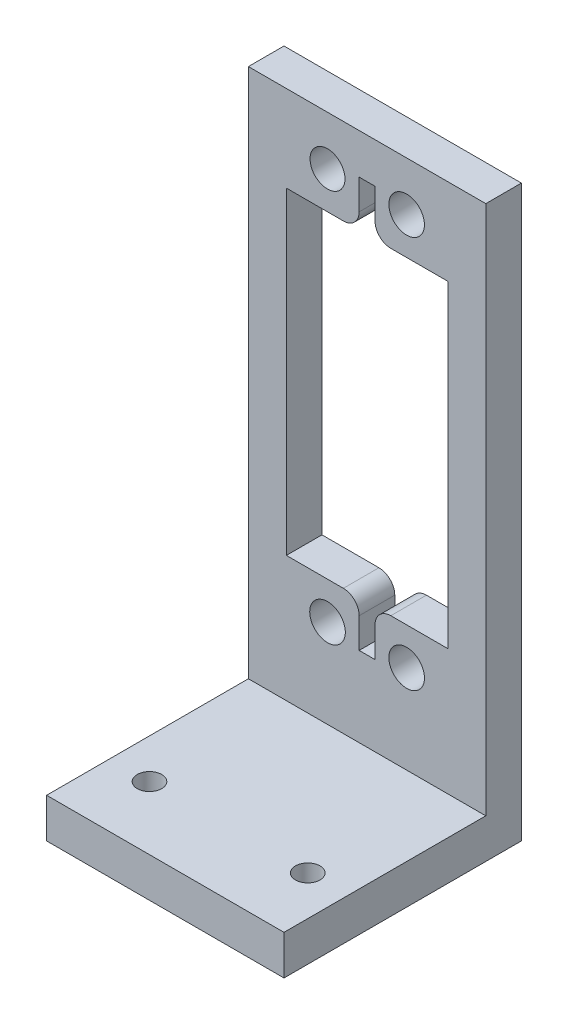
from build123d import *

# Parameters (mm, degrees)
SKETCH_1_W          = 30
SKETCH_1_H          = 62
SKETCH_1_W_2        = 20.4
SKETCH_1_H_2        = 40.2
EXTRUDE_1_DEPTH     = 4.5
SKETCH_3_R          = 2.25
SKETCH_3_R_2        = 2.20649786
CUT_EXTRUDE_1_DEPTH = 35.731109974
SKETCH_5_W          = 30
SKETCH_5_H          = 4.5
EXTRUDE_3_DEPTH     = 5
SKETCH_6_W          = 30
SKETCH_6_H          = 30
EXTRUDE_4_DEPTH     = 5
SKETCH_7_R          = 1.55
CUT_EXTRUDE_2_DEPTH = 80.429213769
SKETCH_8_W          = 2
SKETCH_8_H          = 5.8
CUT_EXTRUDE_3_DEPTH = 51.55937104
FILLET_1_R          = 2


with BuildPart() as part:
    # 草图1 → 凸台-拉伸1 (new body)
    with BuildSketch(Plane.XY):
        Rectangle(SKETCH_1_W, SKETCH_1_H)
        Rectangle(SKETCH_1_W_2, SKETCH_1_H_2, mode=Mode.SUBTRACT)
    extrude(amount=EXTRUDE_1_DEPTH)

    # 草图3 → 切除-拉伸1 (cut, through all)
    with BuildSketch(Plane(origin=(0, 0, 0), x_dir=(-1, 0, 0), z_dir=(0, 0, -1))):
        with Locations((-5, -24.8)):
            Circle(SKETCH_3_R)
        with Locations((5, -24.8)):
            Circle(SKETCH_3_R)
        with Locations((-5, 24.8)):
            Circle(SKETCH_3_R)
        with Locations((5, 24.8)):
            Circle(SKETCH_3_R_2)
    extrude(amount=-CUT_EXTRUDE_1_DEPTH, mode=Mode.SUBTRACT)

    # 草图5 → 凸台-拉伸3 (add)
    with BuildSketch(Plane.XZ.offset(31)):
        with Locations((0, 2.25)):
            Rectangle(SKETCH_5_W, SKETCH_5_H)
    extrude(amount=EXTRUDE_3_DEPTH)

    # 草图6 → 凸台-拉伸4 (add)
    with BuildSketch(Plane.XZ.offset(36)):
        with Locations((0, 15)):
            Rectangle(SKETCH_6_W, SKETCH_6_H)
    extrude(amount=EXTRUDE_4_DEPTH)

    # 草图7 → 切除-拉伸2 (cut, through all)
    with BuildSketch(Plane.XZ.offset(41)):
        with Locations((10, 22)):
            Circle(SKETCH_7_R)
        with Locations((-10, 22)):
            Circle(SKETCH_7_R)
    extrude(amount=-CUT_EXTRUDE_2_DEPTH, mode=Mode.SUBTRACT)

    # 草图8 → 切除-拉伸3 (cut, through all)
    with BuildSketch(Plane.XY.offset(4.5)):
        with Locations((0, -23)):
            Rectangle(SKETCH_8_W, SKETCH_8_H)
        with Locations((0, 23)):
            Rectangle(SKETCH_8_W, SKETCH_8_H)
    extrude(amount=-CUT_EXTRUDE_3_DEPTH, mode=Mode.SUBTRACT)

    # 圆角1
    fillet_1_edges = [part.edges().sort_by_distance(p)[0] for p in [
        (1, 20.1, 2.25),
        (-1, 20.1, 2.25),
        (1, -20.1, 2.25),
        (-1, -20.1, 2.25),
    ]]
    fillet(fillet_1_edges, radius=FILLET_1_R)


solid = part.part
